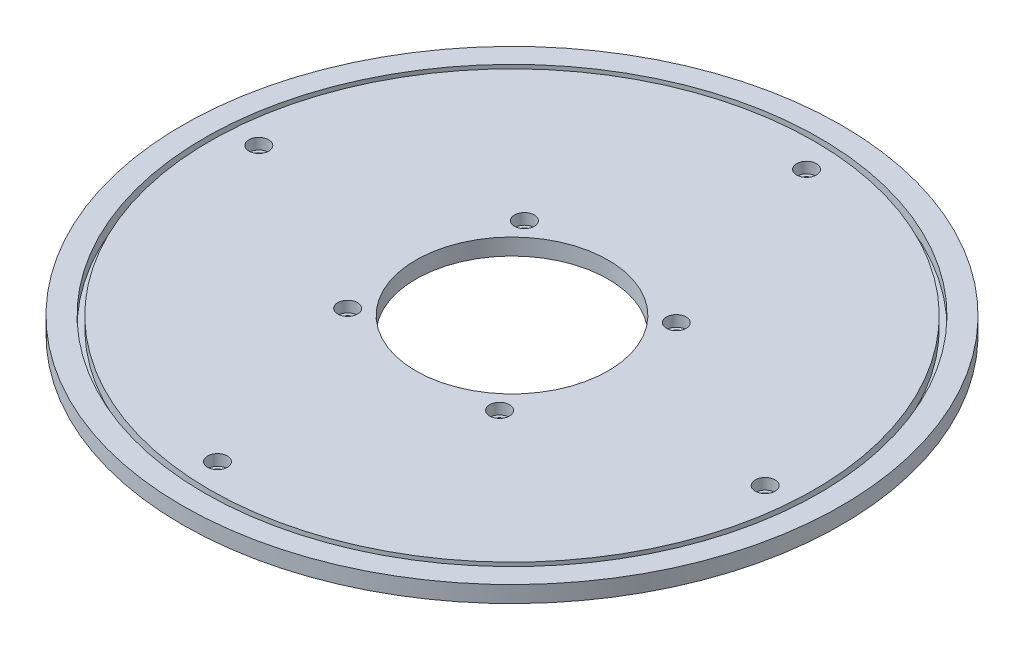
from build123d import *

# Parameters (mm, degrees)
SKETCH1_R                      = 300
PLATE_DEPTH                    = 15
SKETCH2_R                      = 87.5
BEARING_HOLE_DEPTH             = 425.529150943
SKETCH4_R                      = 280
SKETCH4_R_2                    = 275
CUT_EXTRUDE3_DEPTH             = 10
CBORE_FOR_M10_SHCS_D           = 12
CBORE_FOR_M10_SHCS_CBORE_D     = 18
CBORE_FOR_M10_SHCS_CBORE_DEPTH = 10


with BuildPart() as part:
    # Sketch1 → plate (new body)
    with BuildSketch(Plane(origin=(0, 0, 0), x_dir=(1, 0, 0), z_dir=(0, 1, 0))):
        Circle(SKETCH1_R)
    extrude(amount=PLATE_DEPTH)

    # Sketch2 → bearing-hole (cut, through all)
    with BuildSketch(Plane(origin=(0, 15, 0), x_dir=(1, 0, 0), z_dir=(0, 1, 0))):
        Circle(SKETCH2_R)
    extrude(amount=-BEARING_HOLE_DEPTH, mode=Mode.SUBTRACT)

    # Sketch4 → Cut-Extrude3 (cut)
    with BuildSketch(Plane(origin=(0, 15, 0), x_dir=(1, 0, 0), z_dir=(0, 1, 0))):
        Circle(SKETCH4_R)
        Circle(SKETCH4_R_2, mode=Mode.SUBTRACT)
    extrude(amount=-CUT_EXTRUDE3_DEPTH, mode=Mode.SUBTRACT)

    # CBORE for M10 SHCS (through all)
    with Locations(Plane(origin=(0, 15, 0), x_dir=(0.9971609611542523, 0, 0.0752995189222859), z_dir=(0, 1, 0))):
        with Locations((0, 0), (-75, 75), (75, 75), (75, -75), (-75, -75), (0, 250), (-250, 0), (250, 0), (0, -250)):
            CounterBoreHole(CBORE_FOR_M10_SHCS_D / 2, CBORE_FOR_M10_SHCS_CBORE_D / 2, CBORE_FOR_M10_SHCS_CBORE_DEPTH)


solid = part.part
